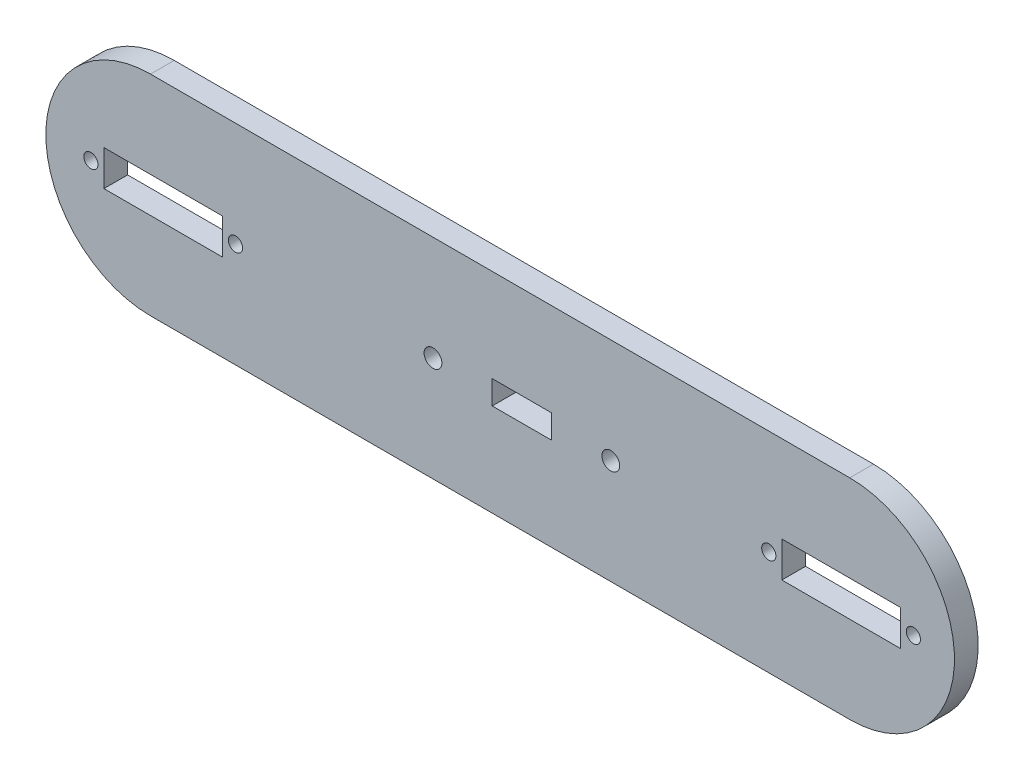
from build123d import *

# Parameters (mm, degrees)
ESBO_O1_R                = 2.25
ESBO_O1_R_2              = 1.8
ESBO_O1_W                = 15
ESBO_O1_H                = 6
ESBO_O1_W_2              = 30
ESBO_O1_H_2              = 9
RESSALTO_EXTRUS_O1_DEPTH = 6


with BuildPart() as part:
    # Esboço1 → Ressalto-extrusão1 (new body)
    with BuildSketch(Plane.XY):
        with BuildLine():
            Line((-94, 26.5), (83, 26.5))
            ThreePointArc((83, 26.5), (109.5, 0), (83, -26.5))
            Line((83, -26.5), (-94, -26.5))
            ThreePointArc((-94, -26.5), (-120.5, 0), (-94, 26.5))
        make_face()
        with Locations((-22.5, 0)):
            Circle(ESBO_O1_R, mode=Mode.SUBTRACT)
        with Locations((22.5, 0)):
            Circle(ESBO_O1_R, mode=Mode.SUBTRACT)
        with Locations((-109.1, 0)):
            Circle(ESBO_O1_R_2, mode=Mode.SUBTRACT)
        with Locations((-72.5, 0)):
            Circle(ESBO_O1_R_2, mode=Mode.SUBTRACT)
        with Locations((62.5, 0)):
            Circle(ESBO_O1_R_2, mode=Mode.SUBTRACT)
        with Locations((99.1, 0)):
            Circle(ESBO_O1_R_2, mode=Mode.SUBTRACT)
        Rectangle(ESBO_O1_W, ESBO_O1_H, mode=Mode.SUBTRACT)
        with Locations((-90.8, 0)):
            Rectangle(ESBO_O1_W_2, ESBO_O1_H_2, mode=Mode.SUBTRACT)
        with Locations((80.8, 0)):
            Rectangle(ESBO_O1_W_2, ESBO_O1_H_2, mode=Mode.SUBTRACT)
    extrude(amount=RESSALTO_EXTRUS_O1_DEPTH)


solid = part.part
